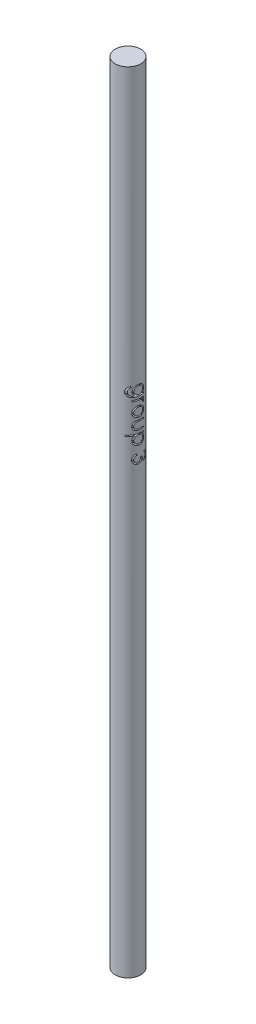
from build123d import *

# Parameters (mm, degrees)
SKETCH1_R           = 1
BOSS_EXTRUDE1_DEPTH = 61.8
CUT_EXTRUDE1_DEPTH  = 1


with BuildPart() as part:
    # Sketch1 → Boss-Extrude1 (new body)
    with BuildSketch(Plane(origin=(0, 0, 0), x_dir=(1, 0, 0), z_dir=(0, 1, 0))):
        Circle(SKETCH1_R)
    extrude(amount=BOSS_EXTRUDE1_DEPTH)

    # Sketch2 → Cut-Extrude1 (cut)
    # profile 1 of 6: a face of its own
    with BuildSketch(Plane(origin=(1, 0, 0), x_dir=(0, 0, -1), z_dir=(1, 0, 0))):
        with BuildLine():
            Line((0.242061908, 39.429853877), (0.242061908, 39.334875244))
            Line((0.242061908, 39.334875244), (-0.371695104, 39.334875244))
            add(Edge.make_bspline(
                [(-0.371695104, 39.334875244), (-0.384769329, 39.334959017), (-0.410005732, 39.335120718), (-0.446496545, 39.336285178), (-0.480201767, 39.338740716), (-0.511275116, 39.341525246), (-0.539572564, 39.345530801), (-0.565178547, 39.350422226), (-0.588117639, 39.355936348), (-0.602246341, 39.360780557), (-0.608929679, 39.363072026)],
                knots=[0, 0, 0, 0, 1.307562039, 2.523909702, 3.650326591, 4.686913197, 5.643429486, 6.506965704, 7.293745905, 8, 8, 8, 8], degree=3))
            add(Edge.make_bspline(
                [(-0.608929679, 39.363072026), (-0.617617362, 39.366455111), (-0.634732973, 39.373120129), (-0.658989962, 39.385608822), (-0.681849842, 39.399571641), (-0.703051408, 39.415575532), (-0.722928236, 39.433215618), (-0.741133236, 39.45281582), (-0.75794895, 39.474027632), (-0.773042685, 39.497023671), (-0.786268787, 39.521570975), (-0.797975353, 39.547343066), (-0.8080859, 39.574265442), (-0.815674664, 39.60259706), (-0.822245663, 39.631907568), (-0.826523073, 39.6625378), (-0.829434022, 39.694309862), (-0.829703224, 39.715913578), (-0.829839802, 39.726874109)],
                knots=[0, 0, 0, 0, 0.981884813, 1.934411902, 2.870642727, 3.801527012, 4.729816098, 5.667674509, 6.616731011, 7.579249157, 8.562291171, 9.552107921, 10.560574871, 11.588648803, 12.640348669, 13.724070705, 14.845319185, 16, 16, 16, 16], degree=3))
            add(Edge.make_bspline(
                [(-0.829839802, 39.726874109), (-0.829581391, 39.742865605), (-0.829076645, 39.774101292), (-0.82317496, 39.819639156), (-0.814884416, 39.862831687), (-0.802203937, 39.903132282), (-0.786750663, 39.9403852), (-0.769149685, 39.974423267), (-0.748764279, 40.004686653), (-0.725640568, 40.031942929), (-0.698132483, 40.056537796), (-0.665718319, 40.079678578), (-0.627900252, 40.101952125), (-0.600143917, 40.115005517), (-0.585609033, 40.121841056)],
                knots=[0, 0, 0, 0, 1.157931887, 2.261752077, 3.322178827, 4.340878186, 5.316509817, 6.24181319, 7.112369066, 7.954886437, 8.824930176, 9.778504873, 10.836691706, 12, 12, 12, 12], degree=3))
            Line((-0.585609033, 40.121841056), (-0.585609033, 40.026862424))
            add(Edge.make_bspline(
                [(-0.585609033, 40.026862424), (-0.597736286, 40.019223613), (-0.621443572, 40.004290678), (-0.652139216, 39.976366257), (-0.678371781, 39.945763391), (-0.699511468, 39.911449297), (-0.715449905, 39.873281196), (-0.726811959, 39.831236126), (-0.733614401, 39.784971955), (-0.734434245, 39.752762876), (-0.734861169, 39.735990362)],
                knots=[0, 0, 0, 0, 0.997731894, 1.950442991, 2.880492273, 3.800895997, 4.748200782, 5.754801363, 6.83083817, 8, 8, 8, 8], degree=3))
            add(Edge.make_bspline(
                [(-0.734861169, 39.735990362), (-0.734430686, 39.719429466), (-0.733600756, 39.687501717), (-0.726778356, 39.641529046), (-0.715478436, 39.599537116), (-0.699598507, 39.561841333), (-0.679985686, 39.529011149), (-0.658286452, 39.50061111), (-0.633730305, 39.477591545), (-0.611119671, 39.462104544), (-0.590973534, 39.452478523), (-0.573631263, 39.446348548), (-0.554020969, 39.441367145), (-0.532208503, 39.437200381), (-0.508162666, 39.433762034), (-0.48182849, 39.431584019), (-0.45326582, 39.430009881), (-0.433461943, 39.429907081), (-0.423212532, 39.429853877)],
                knots=[0, 0, 0, 0, 1.570672572, 3.028099501, 4.397683431, 5.686589315, 6.895122698, 8.017723291, 9.066023084, 10.075791025, 10.603605416, 11.180458235, 11.81795017, 12.521450677, 13.286658401, 14.121327423, 15.027701111, 16, 16, 16, 16], degree=3))
            Line((-0.423212532, 39.429853877), (-0.383143421, 39.429853877))
            add(Edge.make_bspline(
                [(-0.383143421, 39.429853877), (-0.394616299, 39.43949412), (-0.417360251, 39.458605036), (-0.447163413, 39.491609109), (-0.472831362, 39.527658033), (-0.493882711, 39.566690438), (-0.510719713, 39.607750216), (-0.522495323, 39.650392652), (-0.530103197, 39.694235488), (-0.530921838, 39.723945066), (-0.531335528, 39.738958444)],
                knots=[0, 0, 0, 0, 1.012485704, 2.007162095, 2.997754123, 3.998611389, 4.999708251, 5.992315798, 6.98544096, 8, 8, 8, 8], degree=3))
            add(Edge.make_bspline(
                [(-0.531335528, 39.738958444), (-0.531179794, 39.747798935), (-0.530870169, 39.765375299), (-0.528161205, 39.79148733), (-0.524230633, 39.817214034), (-0.518460769, 39.842495411), (-0.511054938, 39.867367942), (-0.501797019, 39.891790522), (-0.491330068, 39.915960901), (-0.479001143, 39.939439713), (-0.465284467, 39.961993174), (-0.450425724, 39.98345096), (-0.434503147, 40.003701442), (-0.417358016, 40.022549073), (-0.399021432, 40.039979462), (-0.379665582, 40.056188633), (-0.359138203, 40.071030048), (-0.337431307, 40.08431136), (-0.315074131, 40.096445153), (-0.291959587, 40.106833881), (-0.268233906, 40.115457861), (-0.244193695, 40.12305824), (-0.219400572, 40.128440246), (-0.194148386, 40.132555643), (-0.168283079, 40.134864646), (-0.150859825, 40.135227068), (-0.14209274, 40.135409433)],
                knots=[0, 0, 0, 0, 1.028796061, 2.045417375, 3.052978994, 4.056772505, 5.061374657, 6.071351207, 7.095367434, 8.125609542, 9.155490328, 10.16637099, 11.162041966, 12.151987513, 13.129482149, 14.104793677, 15.088808581, 16.075021637, 17.065069715, 18.0481558, 19.021557435, 20.00254184, 20.980451754, 21.971763498, 22.979425854, 24, 24, 24, 24], degree=3))
            add(Edge.make_bspline(
                [(-0.14209274, 40.135409433), (-0.133322714, 40.135252556), (-0.11581663, 40.134939412), (-0.089848963, 40.132231175), (-0.064226069, 40.128376405), (-0.039225953, 40.122243342), (-0.014487702, 40.114966043), (0.00958593, 40.105527686), (0.033313534, 40.094653494), (0.056487035, 40.082224812), (0.078893234, 40.068312233), (0.100073228, 40.052998232), (0.120203191, 40.036602951), (0.139024937, 40.018796437), (0.156679541, 39.99968395), (0.173012083, 39.979209931), (0.188317777, 39.957602103), (0.202260701, 39.934786456), (0.214592547, 39.911116951), (0.225844909, 39.887194417), (0.234775469, 39.8627021), (0.242644357, 39.838096592), (0.248218809, 39.812944571), (0.252519344, 39.78755443), (0.255139391, 39.761839247), (0.255466442, 39.744617776), (0.255630284, 39.735990362)],
                knots=[0, 0, 0, 0, 1.008914434, 2.013921196, 3.001938835, 3.98818112, 4.973517748, 5.967241793, 6.960633033, 7.975722852, 8.991170928, 9.993245185, 10.981396684, 11.976616977, 12.972235889, 13.973022409, 14.988340224, 16.01763096, 17.047082309, 18.058647952, 19.057085865, 20.044802253, 21.029198803, 22.0185208, 23.007341325, 24, 24, 24, 24], degree=3))
            add(Edge.make_bspline(
                [(0.255630284, 39.735990362), (0.255226444, 39.721761906), (0.254430968, 39.693734997), (0.247995543, 39.652407112), (0.237965224, 39.612484428), (0.223384265, 39.573762435), (0.203652198, 39.536004777), (0.177327244, 39.499438696), (0.14492939, 39.463438205), (0.119834863, 39.44133372), (0.106802159, 39.429853877)],
                knots=[0, 0, 0, 0, 0.967343326, 1.905452219, 2.838102277, 3.762990896, 4.713322225, 5.726933809, 6.819495538, 8, 8, 8, 8], degree=3))
            Line((0.106802159, 39.429853877), (0.242061908, 39.429853877))
        make_face()
        with BuildLine():
            add(Edge.make_bspline(
                [(0.160651651, 39.72835815), (0.160179619, 39.742246726), (0.159245095, 39.769743162), (0.151266799, 39.810046931), (0.138764816, 39.84895671), (0.120880347, 39.885726644), (0.099083632, 39.920174531), (0.072661875, 39.95072103), (0.042573746, 39.977488759), (0.008805796, 39.999851363), (-0.027458343, 40.017820165), (-0.065633818, 40.030883957), (-0.105280757, 40.039046754), (-0.132301778, 40.039967258), (-0.145908846, 40.0404308)],
                knots=[0, 0, 0, 0, 1.026331696, 2.03191913, 3.02692423, 4.041490544, 5.047661868, 6.033509946, 7.018359977, 8.017132933, 9.01989117, 10.003339456, 10.994534818, 12, 12, 12, 12], degree=3))
            add(Edge.make_bspline(
                [(-0.145908846, 40.0404308), (-0.156169683, 40.040211445), (-0.176349749, 40.039780038), (-0.205963422, 40.035628862), (-0.23417282, 40.028926963), (-0.260960787, 40.019402197), (-0.286583974, 40.007677696), (-0.310568622, 39.992576129), (-0.333354803, 39.975195763), (-0.354474227, 39.955259499), (-0.373738157, 39.933325171), (-0.390576493, 39.909549384), (-0.404537576, 39.884062349), (-0.41642465, 39.857271317), (-0.425169315, 39.828609088), (-0.431830005, 39.798505451), (-0.435643599, 39.766758485), (-0.436116028, 39.745116482), (-0.436356896, 39.734082309)],
                knots=[0, 0, 0, 0, 1.039892369, 2.045164194, 3.025377528, 3.974939947, 4.923826224, 5.876304068, 6.842270891, 7.825700405, 8.815919897, 9.798017152, 10.773083594, 11.758208475, 12.764450271, 13.80592145, 14.881349344, 16, 16, 16, 16], degree=3))
            add(Edge.make_bspline(
                [(-0.436356896, 39.734082309), (-0.436124786, 39.722905173), (-0.435670896, 39.701048401), (-0.431769124, 39.669125761), (-0.425472956, 39.638877763), (-0.416533655, 39.610332159), (-0.405127334, 39.583381103), (-0.390692626, 39.558327595), (-0.374254095, 39.534633543), (-0.355078621, 39.513058796), (-0.333950034, 39.493540216), (-0.31094333, 39.47656548), (-0.286502509, 39.46198687), (-0.260315965, 39.450383772), (-0.232729735, 39.440812582), (-0.20327866, 39.434778527), (-0.172396207, 39.430450889), (-0.151225339, 39.430055906), (-0.140396693, 39.429853877)],
                knots=[0, 0, 0, 0, 1.121992135, 2.194043731, 3.223932285, 4.220423016, 5.193184374, 6.156086365, 7.118779155, 8.084057622, 9.048292205, 10.002025119, 10.950065319, 11.899697616, 12.87359713, 13.875731462, 14.913461982, 16, 16, 16, 16], degree=3))
            add(Edge.make_bspline(
                [(-0.140396693, 39.429853877), (-0.126300342, 39.430258937), (-0.098761025, 39.431050281), (-0.058633029, 39.438518232), (-0.020905347, 39.450559102), (0.014302633, 39.467446109), (0.0466181, 39.488607288), (0.075441657, 39.51409541), (0.10081379, 39.543469859), (0.12194152, 39.576650279), (0.139075198, 39.612396556), (0.151759972, 39.649784461), (0.159112571, 39.688708561), (0.160134768, 39.715042263), (0.160651651, 39.72835815)],
                knots=[0, 0, 0, 0, 1.070930318, 2.092221514, 3.091405799, 4.074392322, 5.052047932, 6.019043127, 6.99061078, 7.993717296, 9.000730765, 9.998165278, 10.987753177, 12, 12, 12, 12], degree=3))
        make_face(mode=Mode.SUBTRACT)
    # profile 2 of 6: a face of its own
    with BuildSketch(Plane(origin=(1, 0, 0), x_dir=(0, 0, -1), z_dir=(1, 0, 0))):
        with BuildLine():
            Line((0.242061908, 39.14491798), (0.242061908, 39.049939347))
            Line((0.242061908, 39.049939347), (0.128214752, 39.049939347))
            add(Edge.make_bspline(
                [(0.128214752, 39.049939347), (0.138816076, 39.04292835), (0.159091025, 39.029519874), (0.185888543, 39.007219558), (0.208175108, 38.98438419), (0.2257331, 38.960729781), (0.238990182, 38.936454075), (0.248782153, 38.91196074), (0.254473981, 38.886742388), (0.255244333, 38.869761589), (0.255630284, 38.861254117)],
                knots=[0, 0, 0, 0, 1.280622107, 2.44917983, 3.507334186, 4.490567186, 5.408878616, 6.288712897, 7.142636019, 8, 8, 8, 8], degree=3))
            add(Edge.make_bspline(
                [(0.255630284, 38.861254117), (0.255278345, 38.854652114), (0.254557873, 38.841136824), (0.2492425, 38.820615403), (0.241078222, 38.79938487), (0.233212835, 38.785684382), (0.229129549, 38.778571826)],
                knots=[0, 0, 0, 0, 0.90119973, 1.844890732, 2.881183062, 4, 4, 4, 4], degree=3))
            Line((0.229129549, 38.778571826), (0.146871269, 38.830725271))
            add(Edge.make_bspline(
                [(0.146871269, 38.830725271), (0.148909397, 38.835293951), (0.152778155, 38.843966181), (0.15735681, 38.856652443), (0.160052813, 38.868348942), (0.160461244, 38.875800685), (0.160651651, 38.879274617)],
                knots=[0, 0, 0, 0, 1.180555205, 2.24091978, 3.179933427, 4, 4, 4, 4], degree=3))
            add(Edge.make_bspline(
                [(0.160651651, 38.879274617), (0.160162319, 38.886972939), (0.159173137, 38.902535034), (0.15084246, 38.925349752), (0.137948832, 38.947588622), (0.123140373, 38.965025408), (0.109134129, 38.978629884), (0.09683628, 38.988343538), (0.083056033, 38.997259964), (0.068018181, 39.005777693), (0.051469077, 39.013538811), (0.033573154, 39.020782212), (0.01430995, 39.02733145), (0.000889519, 39.031065927), (-0.005984967, 39.032978877)],
                knots=[0, 0, 0, 0, 1.135927944, 2.296268816, 3.551388088, 4.924624343, 5.663947748, 6.437790805, 7.238014523, 8.089896346, 8.992356783, 9.939655789, 10.944608424, 12, 12, 12, 12], degree=3))
            add(Edge.make_bspline(
                [(-0.005984967, 39.032978877), (-0.012116399, 39.034409863), (-0.025697052, 39.037579387), (-0.048481011, 39.040661114), (-0.07540007, 39.043705944), (-0.106529159, 39.045851827), (-0.14179054, 39.047840901), (-0.181237934, 39.048962759), (-0.224911828, 39.04990109), (-0.255444549, 39.049926208), (-0.271416324, 39.049939347)],
                knots=[0, 0, 0, 0, 0.566838948, 1.255505196, 2.06880316, 3.007127437, 4.065329342, 5.249902469, 6.561414163, 8, 8, 8, 8], degree=3))
            Line((-0.271416324, 39.049939347), (-0.531335528, 39.049939347))
            Line((-0.531335528, 39.049939347), (-0.531335528, 39.14491798))
            Line((-0.531335528, 39.14491798), (0.242061908, 39.14491798))
        make_face()
    # profile 3 of 6: a face of its own
    with BuildSketch(Plane(origin=(1, 0, 0), x_dir=(0, 0, -1), z_dir=(1, 0, 0))):
        with BuildLine():
            add(Edge.make_bspline(
                [(0.255630284, 38.296470463), (0.25532219, 38.281958456), (0.254718094, 38.253503957), (0.248229775, 38.211838579), (0.238390654, 38.172107618), (0.224540812, 38.134140642), (0.206369277, 38.098251714), (0.184394484, 38.064120405), (0.158467762, 38.031815097), (0.138400657, 38.01245656), (0.128214752, 38.002630319)],
                knots=[0, 0, 0, 0, 1.054042676, 2.066720093, 3.05716247, 4.025731183, 4.997454851, 5.974904663, 6.97207755, 8, 8, 8, 8], degree=3))
            add(Edge.make_bspline(
                [(0.128214752, 38.002630319), (0.118473856, 37.994169109), (0.099180578, 37.977410437), (0.067897571, 37.955921517), (0.035500446, 37.937409284), (0.001558992, 37.922573579), (-0.033630492, 37.910875965), (-0.070188957, 37.902570861), (-0.108035667, 37.897630883), (-0.133739208, 37.896964748), (-0.146756869, 37.896627381)],
                knots=[0, 0, 0, 0, 1.025258237, 2.030674902, 3.01204498, 3.988269485, 4.97094183, 5.956517959, 6.965070386, 8, 8, 8, 8], degree=3))
            add(Edge.make_bspline(
                [(-0.146756869, 37.896627381), (-0.159849982, 37.896924119), (-0.185722583, 37.897510486), (-0.223828439, 37.903057247), (-0.260777827, 37.911684503), (-0.296416047, 37.924031275), (-0.33085206, 37.939863363), (-0.363935365, 37.959182717), (-0.395731591, 37.982124747), (-0.425969375, 38.00813111), (-0.453841919, 38.036871522), (-0.478119938, 38.068057187), (-0.499007362, 38.101097864), (-0.515597784, 38.136444589), (-0.528970819, 38.173594214), (-0.538192388, 38.212783033), (-0.543817795, 38.253976086), (-0.544536775, 38.282106421), (-0.544903904, 38.296470463)],
                knots=[0, 0, 0, 0, 0.998669827, 1.973418153, 2.932281609, 3.89081133, 4.846438734, 5.82045571, 6.809776312, 7.834649874, 8.860672198, 9.859676908, 10.845817165, 11.837296335, 12.833502054, 13.853824644, 14.904110009, 16, 16, 16, 16], degree=3))
            add(Edge.make_bspline(
                [(-0.544903904, 38.296470463), (-0.544533738, 38.31090419), (-0.543808747, 38.339173373), (-0.538234233, 38.380521535), (-0.52887229, 38.419875351), (-0.515763339, 38.457200702), (-0.498871093, 38.492547284), (-0.478201209, 38.525709964), (-0.453829625, 38.556910339), (-0.425972706, 38.585659761), (-0.395730733, 38.611663709), (-0.363935588, 38.634606362), (-0.330852002, 38.653925554), (-0.296416062, 38.669757684), (-0.260777823, 38.682104445), (-0.22382844, 38.690731704), (-0.185722583, 38.696278464), (-0.159849982, 38.696864832), (-0.146756869, 38.697161569)],
                knots=[0, 0, 0, 0, 1.099861214, 2.154133753, 3.1731438, 4.178222029, 5.163564916, 6.153006591, 7.15072618, 8.175428628, 9.198983792, 10.187031731, 11.15979573, 12.114193814, 13.071490482, 14.029120454, 15.002614863, 16, 16, 16, 16], degree=3))
            add(Edge.make_bspline(
                [(-0.146756869, 38.697161569), (-0.133809961, 38.696821902), (-0.108177309, 38.696149418), (-0.070401745, 38.691214407), (-0.033905154, 38.682941701), (0.001148502, 38.671230064), (0.034941217, 38.656257613), (0.067418393, 38.63800551), (0.098559942, 38.61629739), (0.117828285, 38.599605371), (0.127578734, 38.591158631)],
                knots=[0, 0, 0, 0, 1.031353054, 2.041901799, 3.029428768, 4.008703097, 4.981709435, 5.96992636, 6.972712378, 8, 8, 8, 8], degree=3))
            add(Edge.make_bspline(
                [(0.127578734, 38.591158631), (0.137851258, 38.581346391), (0.158053983, 38.562048894), (0.183929551, 38.529594462), (0.206200617, 38.495609973), (0.224363006, 38.459489549), (0.238365525, 38.421417003), (0.248275697, 38.381390754), (0.254689394, 38.339573722), (0.255313528, 38.310981404), (0.255630284, 38.296470463)],
                knots=[0, 0, 0, 0, 1.027951202, 2.021646915, 2.998468564, 3.9668038, 4.943370589, 5.93035926, 6.949632805, 8, 8, 8, 8], degree=3))
        make_face()
        with BuildLine():
            add(Edge.make_bspline(
                [(0.160651651, 38.296894475), (0.160359961, 38.307156551), (0.159784111, 38.327415789), (0.155404682, 38.357236639), (0.148464952, 38.385944118), (0.138609209, 38.413596355), (0.125867593, 38.440086399), (0.110305936, 38.465443398), (0.091841356, 38.489599226), (0.070840853, 38.512368314), (0.048030624, 38.533510004), (0.023502659, 38.551778088), (-0.002039382, 38.567340461), (-0.028728081, 38.580291247), (-0.056816194, 38.589940251), (-0.085990312, 38.596947093), (-0.116308606, 38.601322683), (-0.136919208, 38.601893079), (-0.147392887, 38.602182937)],
                knots=[0, 0, 0, 0, 1.021589593, 2.016807015, 2.994807536, 3.958602519, 4.934347097, 5.916793557, 6.916107818, 7.957073844, 8.998039869, 10.008589932, 10.997041759, 11.972786337, 12.956492182, 13.948170289, 14.957322718, 16, 16, 16, 16], degree=3))
            add(Edge.make_bspline(
                [(-0.147392887, 38.602182937), (-0.160925645, 38.601698346), (-0.187785641, 38.600736524), (-0.227331639, 38.592875349), (-0.265368282, 38.579817572), (-0.301437598, 38.561811771), (-0.334868089, 38.539637085), (-0.364928944, 38.513708339), (-0.390460896, 38.483667057), (-0.411933697, 38.450536203), (-0.428843509, 38.414785283), (-0.440970092, 38.377013678), (-0.448746973, 38.337565307), (-0.449529068, 38.310570068), (-0.449925272, 38.296894475)],
                knots=[0, 0, 0, 0, 1.016977094, 2.018509362, 3.018404954, 4.033172147, 5.041280572, 6.028085189, 7.007940189, 7.995502847, 8.989109012, 9.972200833, 10.97273166, 12, 12, 12, 12], degree=3))
            add(Edge.make_bspline(
                [(-0.449925272, 38.296894475), (-0.449531363, 38.283218096), (-0.448753798, 38.256221304), (-0.440930691, 38.216718046), (-0.428896239, 38.17884292), (-0.411914599, 38.143054829), (-0.390542057, 38.109908887), (-0.364783491, 38.080082121), (-0.334947113, 38.053930079), (-0.301481924, 38.031733437), (-0.265312208, 38.014017759), (-0.227338648, 38.000898575), (-0.187783856, 37.993056253), (-0.160925047, 37.992091887), (-0.147392887, 37.991606014)],
                knots=[0, 0, 0, 0, 1.027082318, 2.027431966, 3.015401697, 4.008827937, 4.996211763, 5.971861488, 6.96198607, 7.969911943, 8.982141629, 9.981856156, 10.983207064, 12, 12, 12, 12], degree=3))
            add(Edge.make_bspline(
                [(-0.147392887, 37.991606014), (-0.136918371, 37.991893715), (-0.116306124, 37.992459867), (-0.085999799, 37.996866326), (-0.056758491, 38.003764323), (-0.028841274, 38.01383586), (-0.001909033, 38.026342168), (0.023425961, 38.042283113), (0.048046217, 38.060466108), (0.070827104, 38.081646592), (0.091918087, 38.104413117), (0.110238674, 38.128750417), (0.125876479, 38.154119193), (0.138610778, 38.180617609), (0.148427017, 38.208207269), (0.155434912, 38.236827591), (0.159768143, 38.266516381), (0.160355265, 38.286703679), (0.160651651, 38.296894475)],
                knots=[0, 0, 0, 0, 1.043020522, 2.052505155, 3.044509714, 4.030878336, 5.003918577, 5.996372628, 7.007255355, 8.048564058, 9.08987276, 10.095126797, 11.077896669, 12.053962454, 13.01807471, 13.98956039, 14.985105429, 16, 16, 16, 16], degree=3))
        make_face(mode=Mode.SUBTRACT)
    # profile 4 of 6: a face of its own
    with BuildSketch(Plane(origin=(1, 0, 0), x_dir=(0, 0, -1), z_dir=(1, 0, 0))):
        with BuildLine():
            Line((0.242061908, 37.720238492), (0.242061908, 37.62525986))
            Line((0.242061908, 37.62525986), (-0.116652035, 37.62525986))
            add(Edge.make_bspline(
                [(-0.116652035, 37.62525986), (-0.127181771, 37.625216951), (-0.147324663, 37.625134867), (-0.176309445, 37.624578201), (-0.202742594, 37.623268864), (-0.226639379, 37.621631826), (-0.247995757, 37.619526609), (-0.266737134, 37.617021878), (-0.283076042, 37.614222308), (-0.292916533, 37.611481916), (-0.297493047, 37.610207443)],
                knots=[0, 0, 0, 0, 1.388932606, 2.656963016, 3.823490214, 4.879454478, 5.816252168, 6.653371382, 7.373723809, 8, 8, 8, 8], degree=3))
            add(Edge.make_bspline(
                [(-0.297493047, 37.610207443), (-0.303245185, 37.608162894), (-0.314629875, 37.604116302), (-0.331076307, 37.596776658), (-0.346307967, 37.587695936), (-0.360917414, 37.577762442), (-0.374452526, 37.566292207), (-0.387001705, 37.553452946), (-0.398711342, 37.539472553), (-0.4128341, 37.518994045), (-0.427779895, 37.49099967), (-0.440855597, 37.454327919), (-0.448555243, 37.414493003), (-0.449460155, 37.38692868), (-0.449925272, 37.372760861)],
                knots=[0, 0, 0, 0, 0.725930277, 1.436768641, 2.137297926, 2.832005607, 3.535753883, 4.242956221, 4.964984144, 5.701683124, 7.198126434, 8.723945959, 10.316137162, 12, 12, 12, 12], degree=3))
            add(Edge.make_bspline(
                [(-0.449925272, 37.372760861), (-0.449461892, 37.358591248), (-0.44856761, 37.331245135), (-0.440971847, 37.291826435), (-0.428579985, 37.25572665), (-0.411039767, 37.223367275), (-0.389655964, 37.194951451), (-0.364553835, 37.171274283), (-0.336538898, 37.151738127), (-0.31563697, 37.143208156), (-0.305125259, 37.13891838)],
                knots=[0, 0, 0, 0, 1.157091467, 2.233085092, 3.266839029, 4.264239195, 5.228693433, 6.160074799, 7.074690074, 8, 8, 8, 8], degree=3))
            add(Edge.make_bspline(
                [(-0.305125259, 37.13891838), (-0.300902206, 37.137649187), (-0.291566067, 37.13484331), (-0.275725583, 37.131850187), (-0.256853603, 37.129042334), (-0.234751939, 37.127170367), (-0.209615491, 37.125033877), (-0.181314268, 37.124296141), (-0.150015088, 37.123242617), (-0.128101671, 37.123234294), (-0.116652035, 37.123229945)],
                knots=[0, 0, 0, 0, 0.557560243, 1.232629526, 2.036798082, 2.970922211, 4.03790722, 5.227863888, 6.551574656, 8, 8, 8, 8], degree=3))
            Line((-0.116652035, 37.123229945), (0.242061908, 37.123229945))
            Line((0.242061908, 37.123229945), (0.242061908, 37.028251313))
            Line((0.242061908, 37.028251313), (-0.134460528, 37.028251313))
            add(Edge.make_bspline(
                [(-0.134460528, 37.028251313), (-0.147253411, 37.028384873), (-0.172073354, 37.028643997), (-0.208142594, 37.030309317), (-0.241755951, 37.033166685), (-0.272931154, 37.03750369), (-0.301644615, 37.042603379), (-0.32793242, 37.049182625), (-0.351715955, 37.057036068), (-0.37340457, 37.065903824), (-0.393089934, 37.076350861), (-0.411662583, 37.087544787), (-0.429091599, 37.100107664), (-0.445462649, 37.113928231), (-0.460716353, 37.128944413), (-0.474786212, 37.145256533), (-0.487921222, 37.162537396), (-0.499864384, 37.181088266), (-0.510510544, 37.200928088), (-0.519792615, 37.22195704), (-0.527460589, 37.244328522), (-0.533730559, 37.267791926), (-0.538922361, 37.2925436), (-0.542402473, 37.318476818), (-0.54461777, 37.345655778), (-0.544806925, 37.364134722), (-0.544903904, 37.373608885)],
                knots=[0, 0, 0, 0, 1.492959813, 2.896546261, 4.212934643, 5.4282803, 6.568701279, 7.614836728, 8.587629399, 9.489753423, 10.345563548, 11.185732697, 12.018869657, 12.849922188, 13.68387515, 14.5140269, 15.361852057, 16.215154979, 17.085973896, 17.987004002, 18.894652782, 19.842944701, 20.819888734, 21.843945232, 22.894589698, 24, 24, 24, 24], degree=3))
            add(Edge.make_bspline(
                [(-0.544903904, 37.373608885), (-0.544801183, 37.383011879), (-0.544599327, 37.401489636), (-0.542439781, 37.428604512), (-0.538869215, 37.454593734), (-0.533772518, 37.479364902), (-0.527410704, 37.502942875), (-0.519850111, 37.525423157), (-0.510451965, 37.54654252), (-0.499875418, 37.566554697), (-0.487911633, 37.585303038), (-0.474797964, 37.602873965), (-0.460553987, 37.619243918), (-0.445239191, 37.634416508), (-0.428663594, 37.648178765), (-0.410960532, 37.660702187), (-0.392305414, 37.672179572), (-0.372329172, 37.682567202), (-0.350384779, 37.691490994), (-0.326104466, 37.699369604), (-0.299222038, 37.705813535), (-0.269760479, 37.711057568), (-0.237860788, 37.715276217), (-0.203338434, 37.718205122), (-0.166277508, 37.719842766), (-0.140680994, 37.72010374), (-0.127464334, 37.720238492)],
                knots=[0, 0, 0, 0, 1.083640291, 2.129454052, 3.13281866, 4.105697902, 5.042300162, 5.946461698, 6.836384745, 7.703652036, 8.553297018, 9.397182691, 10.228592656, 11.052265423, 11.879314572, 12.708807002, 13.549817954, 14.402308542, 15.300838682, 16.27712199, 17.341985831, 18.484375296, 19.725102775, 21.0496083, 22.476576903, 24, 24, 24, 24], degree=3))
            Line((-0.127464334, 37.720238492), (0.242061908, 37.720238492))
        make_face()
    # profile 5 of 6: a face of its own
    with BuildSketch(Plane(origin=(1, 0, 0), x_dir=(0, 0, -1), z_dir=(1, 0, 0))):
        with BuildLine():
            Line((0.242061908, 36.811157296), (0.242061908, 36.716178663))
            Line((0.242061908, 36.716178663), (0.098957941, 36.716178663))
            add(Edge.make_bspline(
                [(0.098957941, 36.716178663), (0.111938257, 36.70608948), (0.137162904, 36.686483172), (0.169900934, 36.652693792), (0.197307257, 36.616859538), (0.218903831, 36.578439345), (0.235269847, 36.537896089), (0.247246229, 36.495270848), (0.25434391, 36.450207832), (0.255195819, 36.419395805), (0.255630284, 36.403682002)],
                knots=[0, 0, 0, 0, 1.082960489, 2.104516986, 3.092433479, 4.050182639, 5.001196938, 5.969027827, 6.964226023, 8, 8, 8, 8], degree=3))
            add(Edge.make_bspline(
                [(0.255630284, 36.403682002), (0.255233203, 36.389956446), (0.254448353, 36.362827163), (0.249134596, 36.322893758), (0.24002758, 36.284438344), (0.22690397, 36.24767848), (0.210679578, 36.212220363), (0.190203236, 36.178588919), (0.166494697, 36.146260296), (0.139210213, 36.116047543), (0.109689285, 36.08813132), (0.077932541, 36.063987356), (0.04498433, 36.043161804), (0.010333864, 36.026328167), (-0.025745998, 36.013141833), (-0.063401027, 36.003763585), (-0.102491609, 35.998182346), (-0.129071717, 35.997433514), (-0.142516752, 35.997054732)],
                knots=[0, 0, 0, 0, 1.041296284, 2.058176809, 3.050446431, 4.034000596, 5.01514041, 6.003636468, 7.015969324, 8.052561599, 9.08815499, 10.094063707, 11.074456064, 12.040834395, 13.011057502, 13.983766392, 14.980127149, 16, 16, 16, 16], degree=3))
            add(Edge.make_bspline(
                [(-0.142516752, 35.997054732), (-0.15624633, 35.997423235), (-0.183323041, 35.998149978), (-0.223070958, 36.003847683), (-0.261382996, 36.012802786), (-0.297894548, 36.026225783), (-0.333133875, 36.042660068), (-0.366505427, 36.063222897), (-0.398327346, 36.087349779), (-0.428062838, 36.114966017), (-0.455462695, 36.144914038), (-0.479410394, 36.176935401), (-0.499608324, 36.210552333), (-0.516244253, 36.245604139), (-0.529066132, 36.282213281), (-0.538142975, 36.32036002), (-0.543789922, 36.360052621), (-0.54452973, 36.38705622), (-0.544903904, 36.40071392)],
                knots=[0, 0, 0, 0, 1.038787011, 2.048637893, 3.033314735, 4.011256821, 4.987456671, 5.971770257, 6.972013799, 8.005388554, 9.039095487, 10.040396776, 11.026510796, 12.002710647, 12.972028308, 13.95670515, 14.966556032, 16, 16, 16, 16], degree=3))
            add(Edge.make_bspline(
                [(-0.544903904, 36.40071392), (-0.54452405, 36.416156002), (-0.543777137, 36.446519964), (-0.535827003, 36.490951974), (-0.524295042, 36.533662179), (-0.506908692, 36.574199394), (-0.485348787, 36.61305371), (-0.458389974, 36.649608919), (-0.427319172, 36.684680711), (-0.403388814, 36.705549125), (-0.391199644, 36.716178663)],
                knots=[0, 0, 0, 0, 1.019281043, 2.00422519, 2.974076634, 3.936751752, 4.91100001, 5.903882226, 6.932321223, 8, 8, 8, 8], degree=3))
            Line((-0.391199644, 36.716178663), (-0.816271426, 36.716178663))
            Line((-0.816271426, 36.716178663), (-0.816271426, 36.811157296))
            Line((-0.816271426, 36.811157296), (0.242061908, 36.811157296))
        make_face()
        with BuildLine():
            add(Edge.make_bspline(
                [(0.160651651, 36.404530025), (0.160457761, 36.415288464), (0.160076041, 36.436469057), (0.155552325, 36.467517227), (0.148964141, 36.497413819), (0.139088636, 36.525841056), (0.126678538, 36.553030255), (0.111683837, 36.579028591), (0.093430841, 36.603398845), (0.072981887, 36.626429751), (0.050562434, 36.647470233), (0.026416344, 36.665886881), (0.000876112, 36.681383229), (-0.025925428, 36.694231784), (-0.054180718, 36.70401265), (-0.083733535, 36.710953782), (-0.114614951, 36.715317312), (-0.135647371, 36.715888481), (-0.146332857, 36.716178663)],
                knots=[0, 0, 0, 0, 1.056783697, 2.080534709, 3.078213817, 4.062450963, 5.032388505, 6.013014931, 7.006476528, 8.020136409, 9.037574406, 10.02408906, 10.99988041, 11.969394914, 12.94050107, 13.932990591, 14.949859205, 16, 16, 16, 16], degree=3))
            add(Edge.make_bspline(
                [(-0.146332857, 36.716178663), (-0.160357599, 36.715691348), (-0.187833254, 36.714736656), (-0.228037076, 36.707159781), (-0.26593937, 36.694349967), (-0.301519847, 36.676744418), (-0.334077311, 36.654336336), (-0.363464627, 36.627633791), (-0.389020466, 36.596333135), (-0.410631642, 36.561252987), (-0.428162112, 36.52362565), (-0.440716273, 36.484382031), (-0.448448554, 36.444054728), (-0.449430367, 36.416789586), (-0.449925272, 36.403045984)],
                knots=[0, 0, 0, 0, 1.037446521, 2.0324456, 3.014856775, 3.990198243, 4.96070402, 5.930645943, 6.919052903, 7.940784962, 8.972706292, 9.9832942, 10.983434506, 12, 12, 12, 12], degree=3))
            add(Edge.make_bspline(
                [(-0.449925272, 36.403045984), (-0.449454649, 36.389579222), (-0.448520548, 36.362850119), (-0.440435486, 36.323492703), (-0.428084511, 36.285244649), (-0.410075663, 36.248903291), (-0.388001762, 36.214791972), (-0.36153673, 36.183968828), (-0.330775106, 36.157089333), (-0.296731089, 36.133901105), (-0.26006427, 36.115382579), (-0.22206883, 36.101811784), (-0.183067574, 36.093722877), (-0.1567576, 36.092597272), (-0.143576781, 36.092033364)],
                knots=[0, 0, 0, 0, 1.000942316, 1.986690553, 2.977613063, 3.984008645, 4.994597959, 5.993715906, 6.995776077, 8.025307715, 9.050480445, 10.043228463, 11.019692995, 12, 12, 12, 12], degree=3))
            add(Edge.make_bspline(
                [(-0.143576781, 36.092033364), (-0.13031672, 36.092474824), (-0.103899908, 36.093354306), (-0.064951736, 36.101962864), (-0.026965299, 36.115015752), (0.009374266, 36.133579069), (0.043271809, 36.156350854), (0.073460621, 36.183426861), (0.099804468, 36.213874709), (0.121584586, 36.247943432), (0.138905541, 36.284515221), (0.151570645, 36.323012372), (0.15918263, 36.363242344), (0.16015767, 36.390646404), (0.160651651, 36.404530025)],
                knots=[0, 0, 0, 0, 0.983883291, 1.96010114, 2.949781603, 3.961842304, 4.982704228, 5.97556912, 6.965945748, 7.965066277, 8.970293822, 9.964878779, 10.968953791, 12, 12, 12, 12], degree=3))
        make_face(mode=Mode.SUBTRACT)
    # profile 6 of 6: a face of its own
    with BuildSketch(Plane(origin=(1, 0, 0), x_dir=(0, 0, -1), z_dir=(1, 0, 0))):
        with BuildLine():
            Line((0.282767036, 35.332204304), (0.282767036, 35.427182937))
            add(Edge.make_bspline(
                [(0.282767036, 35.427182937), (0.293420668, 35.424609811), (0.314247647, 35.41957956), (0.344004128, 35.409087674), (0.372162907, 35.3976579), (0.39819672, 35.383933099), (0.422628769, 35.368962595), (0.444904909, 35.351810724), (0.465591687, 35.333268808), (0.483950214, 35.312759835), (0.500574432, 35.291251883), (0.514748556, 35.268441891), (0.526941812, 35.244788778), (0.536986977, 35.220128664), (0.544554219, 35.194388131), (0.550044491, 35.167799888), (0.553609899, 35.140294258), (0.553957868, 35.121622962), (0.554134557, 35.112142205)],
                knots=[0, 0, 0, 0, 1.162005537, 2.271625781, 3.343758855, 4.383309926, 5.390229558, 6.379919256, 7.361854164, 8.333198761, 9.295911338, 10.242430842, 11.177959212, 12.116337295, 13.062827104, 14.020064771, 14.994644689, 16, 16, 16, 16], degree=3))
            add(Edge.make_bspline(
                [(0.554134557, 35.112142205), (0.553717504, 35.098328614), (0.552892495, 35.071002746), (0.545358844, 35.03085773), (0.533437435, 34.992144858), (0.516965618, 34.955287871), (0.496649454, 34.921052774), (0.472469641, 34.89059207), (0.444892709, 34.864318639), (0.4144331, 34.842276768), (0.381880125, 34.825018375), (0.348376268, 34.812292258), (0.314001005, 34.804544749), (0.290791066, 34.803540676), (0.279162936, 34.803037638)],
                knots=[0, 0, 0, 0, 1.083050992, 2.142477498, 3.193116406, 4.255571735, 5.30263384, 6.308962982, 7.297363603, 8.282367274, 9.249857812, 10.179914175, 11.08814088, 12, 12, 12, 12], degree=3))
            add(Edge.make_bspline(
                [(0.279162936, 34.803037638), (0.267972786, 34.803389485), (0.246075399, 34.804077997), (0.214107232, 34.809924141), (0.18397751, 34.819762487), (0.155559397, 34.833390725), (0.129033076, 34.851032099), (0.104338867, 34.872402176), (0.08136724, 34.89765179), (0.06820778, 34.916786136), (0.061432901, 34.926637063)],
                knots=[0, 0, 0, 0, 1.024540389, 2.004866551, 2.965041327, 3.920577974, 4.882998113, 5.874504559, 6.905732034, 8, 8, 8, 8], degree=3))
            add(Edge.make_bspline(
                [(0.061432901, 34.926637063), (0.055996644, 34.91537889), (0.045225848, 34.893073192), (0.024102797, 34.862668627), (-0.000286146, 34.835067937), (-0.019318805, 34.819675621), (-0.028881602, 34.811941884)],
                knots=[0, 0, 0, 0, 1.015518401, 2.012035669, 3.001164323, 4, 4, 4, 4], degree=3))
            add(Edge.make_bspline(
                [(-0.028881602, 34.811941884), (-0.035853084, 34.80684731), (-0.049681885, 34.796741589), (-0.071928755, 34.784303034), (-0.094348558, 34.772889821), (-0.117822813, 34.764490026), (-0.141597484, 34.757241337), (-0.166181683, 34.75247194), (-0.191341838, 34.749410179), (-0.208370937, 34.748980245), (-0.216930814, 34.748764133)],
                knots=[0, 0, 0, 0, 1.02516404, 2.033540309, 3.025129118, 4.011046665, 4.991655828, 5.976607087, 6.982917762, 8, 8, 8, 8], degree=3))
            add(Edge.make_bspline(
                [(-0.216930814, 34.748764133), (-0.231749831, 34.749307955), (-0.261318126, 34.750393039), (-0.30501337, 34.760052539), (-0.347652331, 34.775113754), (-0.388603241, 34.796127981), (-0.426838277, 34.8221281), (-0.460893034, 34.853231914), (-0.490362753, 34.888683293), (-0.514906001, 34.928250217), (-0.534539541, 34.971099015), (-0.548163075, 35.01693361), (-0.557037013, 35.065087514), (-0.557988529, 35.09810976), (-0.558472281, 35.114898281)],
                knots=[0, 0, 0, 0, 0.95570045, 1.906903359, 2.87519758, 3.868912786, 4.869932978, 5.851730567, 6.836639976, 7.83677598, 8.849487602, 9.869908895, 10.917060885, 12, 12, 12, 12], degree=3))
            add(Edge.make_bspline(
                [(-0.558472281, 35.114898281), (-0.558209749, 35.126213165), (-0.557693176, 35.148477083), (-0.554161789, 35.181207855), (-0.547712002, 35.212450369), (-0.539032669, 35.242246866), (-0.528028499, 35.270623818), (-0.514324988, 35.297494631), (-0.498204605, 35.323024622), (-0.479477068, 35.346972877), (-0.458527711, 35.369336539), (-0.434984629, 35.389521291), (-0.409283033, 35.407863657), (-0.381124395, 35.423872502), (-0.350872615, 35.43827701), (-0.318140331, 35.450124585), (-0.283220162, 35.460552364), (-0.258885226, 35.465400578), (-0.246399631, 35.467888065)],
                knots=[0, 0, 0, 0, 1.048658725, 2.063410685, 3.046034179, 4.001477787, 4.936774919, 5.862367409, 6.792675028, 7.730719943, 8.675894397, 9.627829632, 10.600096036, 11.597688215, 12.626045268, 13.701542398, 14.82072376, 16, 16, 16, 16], degree=3))
            Line((-0.246399631, 35.467888065), (-0.246399631, 35.372909433))
            add(Edge.make_bspline(
                [(-0.246399631, 35.372909433), (-0.254548499, 35.370434961), (-0.270398756, 35.365621899), (-0.293210467, 35.357429099), (-0.314122545, 35.348095122), (-0.333288394, 35.33808191), (-0.350896763, 35.327565571), (-0.366482043, 35.315798438), (-0.380728783, 35.303652054), (-0.388755368, 35.294496154), (-0.392683685, 35.290015135)],
                knots=[0, 0, 0, 0, 1.198163088, 2.33053128, 3.407730985, 4.417276592, 5.372219308, 6.28897303, 7.162600585, 8, 8, 8, 8], degree=3))
            add(Edge.make_bspline(
                [(-0.392683685, 35.290015135), (-0.397252158, 35.284089503), (-0.406375001, 35.272256532), (-0.41801716, 35.252974233), (-0.428104898, 35.232695089), (-0.435810683, 35.210979699), (-0.442335356, 35.188296662), (-0.446605132, 35.164279339), (-0.449534651, 35.139139624), (-0.449793166, 35.121974133), (-0.449925272, 35.113202234)],
                knots=[0, 0, 0, 0, 0.946170439, 1.889420265, 2.845303464, 3.807233317, 4.801018734, 5.828864929, 6.890507805, 8, 8, 8, 8], degree=3))
            add(Edge.make_bspline(
                [(-0.449925272, 35.113202234), (-0.449739337, 35.103298065), (-0.449375757, 35.083931317), (-0.446022442, 35.05567422), (-0.441160032, 35.028783609), (-0.433554277, 35.003533902), (-0.424429917, 34.979581512), (-0.412484456, 34.957461126), (-0.398993988, 34.936522432), (-0.38330198, 34.917378836), (-0.366340618, 34.900119949), (-0.348346124, 34.885206363), (-0.329876444, 34.872289493), (-0.31050072, 34.861906484), (-0.29040901, 34.853693037), (-0.269526112, 34.84810504), (-0.248027872, 34.844218729), (-0.233414083, 34.843902288), (-0.226047067, 34.843742766)],
                knots=[0, 0, 0, 0, 1.216990249, 2.379719373, 3.493992396, 4.571561497, 5.616923107, 6.638958652, 7.655775068, 8.674704564, 9.676001865, 10.625896028, 11.54399481, 12.441854662, 13.322657739, 14.20572845, 15.095482574, 16, 16, 16, 16], degree=3))
            add(Edge.make_bspline(
                [(-0.226047067, 34.843742766), (-0.216186008, 34.844205492), (-0.196512958, 34.845128641), (-0.167569953, 34.852176834), (-0.139682699, 34.863769297), (-0.113330999, 34.880000722), (-0.088896151, 34.899749811), (-0.067179561, 34.922825391), (-0.049080035, 34.949284068), (-0.036621001, 34.973792854), (-0.028317578, 34.995554305), (-0.022495374, 35.014140313), (-0.017841206, 35.034966323), (-0.013339225, 35.057782321), (-0.00956505, 35.082684535), (-0.00640403, 35.109695399), (-0.003878691, 35.138825781), (-0.002750326, 35.158991879), (-0.002168862, 35.169383791)],
                knots=[0, 0, 0, 0, 1.070481957, 2.135637345, 3.216366529, 4.339485895, 5.485746587, 6.620975969, 7.768829582, 8.956804399, 9.598399438, 10.297751078, 11.070570279, 11.915248466, 12.824061284, 13.805856426, 14.869322739, 16, 16, 16, 16], degree=3))
            Line((-0.002168862, 35.169383791), (0.106378147, 35.169383791))
            add(Edge.make_bspline(
                [(0.106378147, 35.169383791), (0.106601306, 35.156290706), (0.107038421, 35.130644567), (0.112288634, 35.093176195), (0.119632992, 35.057304657), (0.130622846, 35.023848762), (0.143813808, 34.993454333), (0.158687581, 34.966939954), (0.175538899, 34.944934004), (0.194146603, 34.927381505), (0.214336632, 34.914498593), (0.235159642, 34.904828692), (0.257100115, 34.899159804), (0.272064944, 34.89839879), (0.279586948, 34.89801627)],
                knots=[0, 0, 0, 0, 1.321708579, 2.588902423, 3.815526512, 5.016621128, 6.138757764, 7.158873101, 8.079948563, 8.928590313, 9.728601868, 10.489025425, 11.240515403, 12, 12, 12, 12], degree=3))
            add(Edge.make_bspline(
                [(0.279586948, 34.89801627), (0.285113803, 34.898141566), (0.296109219, 34.898390835), (0.312173033, 34.901534988), (0.327746666, 34.906258601), (0.342759454, 34.912756723), (0.357124256, 34.921438493), (0.370858694, 34.931859508), (0.384192944, 34.9440248), (0.396489079, 34.958252307), (0.408087483, 34.9736551), (0.418113872, 34.990378111), (0.426612232, 35.008052493), (0.433633689, 35.026694498), (0.438912124, 35.046378807), (0.442702982, 35.067009033), (0.445072868, 35.088625599), (0.445414089, 35.103373234), (0.445587549, 35.11087017)],
                knots=[0, 0, 0, 0, 0.884317272, 1.759307272, 2.611736065, 3.488921043, 4.37244062, 5.294096728, 6.247679003, 7.258495569, 8.302441962, 9.333537773, 10.376747089, 11.440883505, 12.520330301, 13.637364711, 14.798958396, 16, 16, 16, 16], degree=3))
            add(Edge.make_bspline(
                [(0.445587549, 35.11087017), (0.445167643, 35.122920953), (0.444347471, 35.146458936), (0.437138522, 35.180385041), (0.425716687, 35.211891391), (0.411924855, 35.235892874), (0.398357387, 35.25364649), (0.386685294, 35.266576291), (0.373451531, 35.279041943), (0.358293112, 35.290554284), (0.341731272, 35.301803157), (0.323674795, 35.312681151), (0.303866251, 35.322838866), (0.289936311, 35.329022034), (0.282767036, 35.332204304)],
                knots=[0, 0, 0, 0, 1.4727372, 2.876598283, 4.222346151, 5.558423782, 6.24313385, 6.953189256, 7.68715613, 8.463578749, 9.278833271, 10.135787152, 11.040551781, 12, 12, 12, 12], degree=3))
        make_face()
    extrude(amount=-CUT_EXTRUDE1_DEPTH, mode=Mode.SUBTRACT)


solid = part.part
